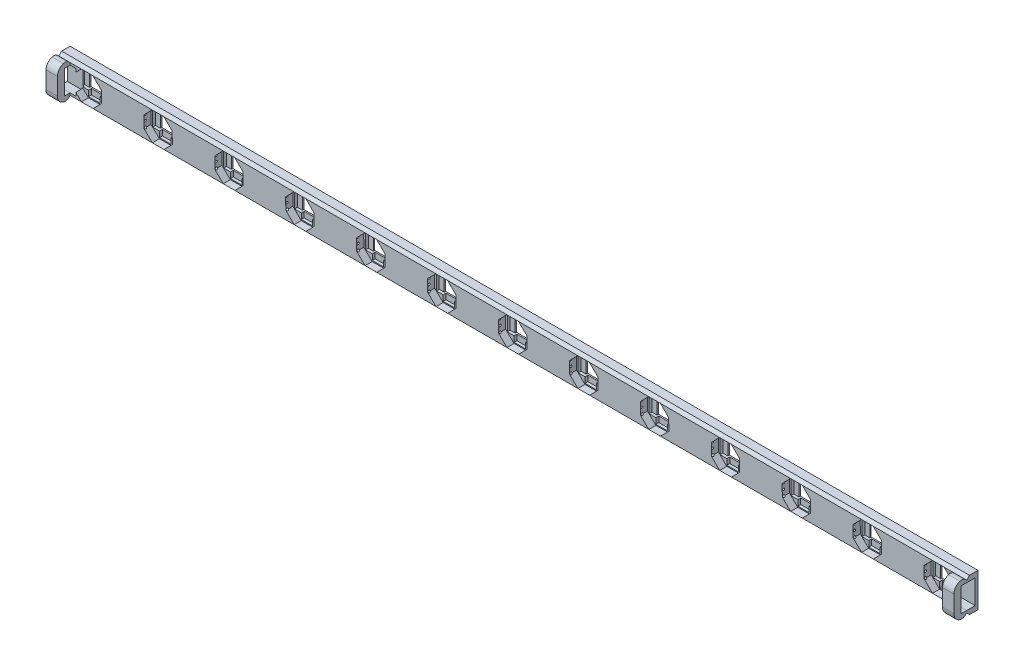
from build123d import *

# Parameters (mm, degrees)
SKETCH1_W                = 320
SKETCH1_H                = 12
BOSS_EXTRUDE1_DEPTH      = 4
CUT_EXTRUDE1_DEPTH       = 2.5
SKETCH4_W                = 5.3
SKETCH4_H                = 5.3
CUT_EXTRUDE2_DEPTH       = 330.788716717
SKETCH6_W                = 4
SKETCH6_H                = 2
CUT_EXTRUDE3_DEPTH       = 1
SKETCH7_W                = 4
SKETCH7_H                = 2
CUT_EXTRUDE4_DEPTH       = 1
SKETCH10_W               = 1.75
SKETCH10_H               = 5.333464967
SKETCH10_H_2             = 5.3
CUT_EXTRUDE7_DEPTH       = 1
CUT_EXTRUDE8_DEPTH       = 321.107409259
CUT_EXTRUDE8_DEPTH_BACK  = 321.107409259
SKETCH11_R               = 0.375
CUT_EXTRUDE9_DEPTH       = 321.107409259
CUT_EXTRUDE9_DEPTH_BACK  = 321.107409259
SKETCH12_R               = 0.375
CUT_EXTRUDE10_DEPTH      = 321.107409259
CUT_EXTRUDE10_DEPTH_BACK = 321.107409259
SKETCH13_R               = 0.375
CUT_EXTRUDE11_DEPTH      = 330.803498577
CUT_EXTRUDE11_DEPTH_BACK = 3
SKETCH14_W               = 6
SKETCH14_H               = 8.5
SKETCH15_W               = 4
SKETCH15_H               = 12
BOSS_EXTRUDE2_DEPTH      = 4.5
SKETCH16_W               = 2
SKETCH16_H               = 8.500297862
CUT_EXTRUDE12_DEPTH      = 4.5
FILLET1_R                = 3
FILLET2_R                = 3
SKETCH17_W               = 6
SKETCH17_H               = 8.5
CUT_EXTRUDE13_DEPTH      = 3
SKETCH18_W               = 4
SKETCH18_H               = 12
BOSS_EXTRUDE3_DEPTH      = 4.5
SKETCH19_W               = 2
SKETCH19_H               = 8.49933276
CUT_EXTRUDE14_DEPTH      = 4.5
FILLET3_R                = 3
FILLET4_R                = 3
CHAMFER1_SIZE            = 1
CHAMFER2_SIZE            = 1
CUT_EXTRUDE15_DEPTH      = 317.197728427
CUT_EXTRUDE15_DEPTH_BACK = 317.197728427
CUT_EXTRUDE16_DEPTH      = 317.197728427
CUT_EXTRUDE16_DEPTH_BACK = 317.197728427
CHAMFER3_SIZE            = 1
CHAMFER4_SIZE            = 1
CHAMFER5_SIZE            = 1
CHAMFER6_SIZE            = 1
FILLET5_R                = 2
FILLET6_R                = 2
FILLET7_R                = 2
FILLET8_R                = 2
LPATTERN1_COUNT          = 13
LPATTERN1_PITCH          = 25


# Some blends are built 0.0001 mm under size
with BuildPart() as part:
    # Sketch1 → Boss-Extrude1 (new body)
    with BuildSketch(Plane.XY):
        with Locations((-169.69924812, 1.263157895)):
            Rectangle(SKETCH1_W, SKETCH1_H)
    extrude(amount=BOSS_EXTRUDE1_DEPTH)

    # Sketch3 → Cut-Extrude1 (cut)
    with BuildSketch(Plane.XY.offset(4)):
        Polygon((-17.589220634, -3.720526073), (-14.683236648, -0.76882409), (-14.715564153, 3.373185381), (-17.667266136, 6.279169368), (-21.809275607, 6.246841862), (-24.715259593, 3.295139879), (-24.682932088, -0.846869592), (-21.731230105, -3.752853578), align=None)
    cut_extrude1 = extrude(amount=-CUT_EXTRUDE1_DEPTH, mode=Mode.SUBTRACT)

    # Sketch4 → Cut-Extrude2 (cut, through all)
    with BuildSketch(Plane.XY.offset(1.5)):
        with Locations((-19.69924812, 1.263157895)):
            Rectangle(SKETCH4_W, SKETCH4_H)
    cut_extrude2 = extrude(amount=-CUT_EXTRUDE2_DEPTH, mode=Mode.SUBTRACT)

    # Sketch6 → Cut-Extrude3 (cut)
    with BuildSketch(Plane.XY.offset(1.5)):
        with Locations((-19.69924812, -2.386842105)):
            Rectangle(SKETCH6_W, SKETCH6_H)
    cut_extrude3 = extrude(amount=-CUT_EXTRUDE3_DEPTH, mode=Mode.SUBTRACT)

    # Sketch7 → Cut-Extrude4 (cut)
    with BuildSketch(Plane.XY.offset(1.5)):
        with Locations((-19.69924812, 4.913157895)):
            Rectangle(SKETCH7_W, SKETCH7_H)
    cut_extrude4 = extrude(amount=-CUT_EXTRUDE4_DEPTH, mode=Mode.SUBTRACT)

    # Sketch10 → Cut-Extrude7 (cut)
    with BuildSketch(Plane.XY.offset(1.5)):
        with Locations((-16.17424812, 1.246425412)):
            Rectangle(SKETCH10_W, SKETCH10_H)
        with Locations((-23.22424812, 1.263157895)):
            Rectangle(SKETCH10_W, SKETCH10_H_2)
    cut_extrude7 = extrude(amount=-CUT_EXTRUDE7_DEPTH, mode=Mode.SUBTRACT)

    # Sketch11 → Cut-Extrude8 (cut, two sides: drawn at the far end of the back side and taken through both)
    with BuildSketch(Plane(origin=(-9.69924812, 0, 0), x_dir=(0, 0, -1), z_dir=(1, 0, 0)).offset(-CUT_EXTRUDE8_DEPTH_BACK)):
        with Locations(Location((-3.5, 1.263157895, 0), (0, 0, 270))):
            Circle(SKETCH11_R)
    extrude(amount=CUT_EXTRUDE8_DEPTH + CUT_EXTRUDE8_DEPTH_BACK, mode=Mode.SUBTRACT)

    # Sketch12 → Cut-Extrude9 (cut, two sides: drawn at the far end of the back side and taken through both)
    with BuildSketch(Plane(origin=(-9.69924812, 0, 0), x_dir=(0, 0, -1), z_dir=(1, 0, 0)).offset(-CUT_EXTRUDE9_DEPTH_BACK)):
        with Locations(Location((-3.5, -0.736842105, 0), (0, 0, 355.107569496))):
            Circle(SKETCH12_R)
    extrude(amount=CUT_EXTRUDE9_DEPTH + CUT_EXTRUDE9_DEPTH_BACK, mode=Mode.SUBTRACT)

    # Sketch13 → Cut-Extrude10 (cut, two sides: drawn at the far end of the back side and taken through both)
    with BuildSketch(Plane(origin=(-9.69924812, 0, 0), x_dir=(0, 0, -1), z_dir=(1, 0, 0)).offset(-CUT_EXTRUDE10_DEPTH_BACK)):
        with Locations(Location((-3.5, 3.263157895, 0), (0, 0, 17.062016504))):
            Circle(SKETCH13_R)
    extrude(amount=CUT_EXTRUDE10_DEPTH + CUT_EXTRUDE10_DEPTH_BACK, mode=Mode.SUBTRACT)

    # Sketch14 → Cut-Extrude11 (cut, two sides: drawn at the far end of the back side and taken through both)
    with BuildSketch(Plane.XY.offset(4).offset(-CUT_EXTRUDE11_DEPTH_BACK)):
        with Locations((-12.69924812, 1.263157895)):
            Rectangle(SKETCH14_W, SKETCH14_H)
    extrude(amount=CUT_EXTRUDE11_DEPTH + CUT_EXTRUDE11_DEPTH_BACK, mode=Mode.SUBTRACT)

    # Sketch15 → Boss-Extrude2 (add)
    with BuildSketch(Plane.XY.offset(4)):
        with Locations((-11.69924812, 1.263157895)):
            Rectangle(SKETCH15_W, SKETCH15_H)
    extrude(amount=BOSS_EXTRUDE2_DEPTH)

    # Sketch16 → Cut-Extrude12 (cut)
    with BuildSketch(Plane(origin=(-9.69924812, 0, 0), x_dir=(0, 0, -1), z_dir=(1, 0, 0))):
        with Locations((-5, 1.263008964)):
            Rectangle(SKETCH16_W, SKETCH16_H)
    extrude(amount=-CUT_EXTRUDE12_DEPTH, mode=Mode.SUBTRACT)

    # Fillet1
    fillet1_edges = [part.edges().sort_by_distance(p)[0] for p in [
        (-11.69924812, 7.263157895, 8.5),
    ]]
    fillet(fillet1_edges, radius=FILLET1_R)

    # Fillet2
    fillet2_edges = [part.edges().sort_by_distance(p)[0] for p in [
        (-11.69924812, -4.736842105, 8.5),
    ]]
    fillet(fillet2_edges, radius=FILLET2_R)

    # Sketch17 → Cut-Extrude13 (cut)
    with BuildSketch(Plane.XY.offset(4)):
        with Locations((-326.69924812, 1.263157895)):
            Rectangle(SKETCH17_W, SKETCH17_H)
    extrude(amount=-CUT_EXTRUDE13_DEPTH, mode=Mode.SUBTRACT)

    # Sketch18 → Boss-Extrude3 (add)
    with BuildSketch(Plane.XY.offset(4)):
        with Locations((-327.69924812, 1.263157895)):
            Rectangle(SKETCH18_W, SKETCH18_H)
    extrude(amount=BOSS_EXTRUDE3_DEPTH)

    # Sketch19 → Cut-Extrude14 (cut)
    with BuildSketch(Plane.ZY.offset(329.69924812)):
        with Locations((5, 1.263491515)):
            Rectangle(SKETCH19_W, SKETCH19_H)
    extrude(amount=-CUT_EXTRUDE14_DEPTH, mode=Mode.SUBTRACT)

    # Fillet3
    fillet3_edges = [part.edges().sort_by_distance(p)[0] for p in [
        (-327.69924812, 7.263157895, 8.5),
    ]]
    fillet(fillet3_edges, radius=FILLET3_R)

    # Fillet4
    fillet4_edges = [part.edges().sort_by_distance(p)[0] for p in [
        (-327.69924812, -4.736842105, 8.5),
    ]]
    fillet(fillet4_edges, radius=FILLET4_R)

    # Chamfer1
    # the kernel refuses this chamfer: 1 mm, written as the material it takes off along each edge
    with BuildSketch(Plane(origin=(-325.69924812, 7.263157895, 4), x_dir=(0, 0.027495876610586487, -0.9996219169112968), z_dir=(1, 0, 0))) as chamfer1_piece_1:
        Polygon((CHAMFER1_SIZE * 0.999621916911, -CHAMFER1_SIZE * 0.0274958766106), (-CHAMFER1_SIZE * 0.0274958766106, -CHAMFER1_SIZE * 0.999621916911), (0, 0), align=None)
    extrude(amount=312, mode=Mode.SUBTRACT)

    # Chamfer2
    # the kernel refuses this chamfer: 1 mm, written as the material it takes off along each edge
    with BuildSketch(Plane(origin=(-13.69924812, -4.736842105, 4), x_dir=(0, 0.9996219169112968, 0.027495876610586487), z_dir=(-1, 0, 0))) as chamfer2_piece_1:
        Polygon((CHAMFER2_SIZE * 0.999621916911, CHAMFER2_SIZE * 0.0274958766106), (-CHAMFER2_SIZE * 0.0274958766106, CHAMFER2_SIZE * 0.999621916911), (0, 0), align=None)
    extrude(amount=312, mode=Mode.SUBTRACT)

    # Sketch30 → Cut-Extrude15 (cut, two sides: drawn at the far end of the back side and taken through both)
    with BuildSketch(Plane(origin=(-325.69924812, 0, 0), x_dir=(0, 0, -1), z_dir=(1, 0, 0)).offset(-CUT_EXTRUDE15_DEPTH_BACK)):
        Polygon((-3, -4.736842105), (-4, -3.736842105), (-4, -4.736842105), align=None)
    extrude(amount=CUT_EXTRUDE15_DEPTH + CUT_EXTRUDE15_DEPTH_BACK, mode=Mode.SUBTRACT)

    # Sketch31 → Cut-Extrude16 (cut, two sides: drawn at the far end of the back side and taken through both)
    with BuildSketch(Plane(origin=(-325.69924812, 0, 0), x_dir=(0, 0, -1), z_dir=(1, 0, 0)).offset(-CUT_EXTRUDE16_DEPTH_BACK)):
        Polygon((-4, 6.263157895), (-3, 7.263157895), (-4, 7.263157895), align=None)
    extrude(amount=CUT_EXTRUDE16_DEPTH + CUT_EXTRUDE16_DEPTH_BACK, mode=Mode.SUBTRACT)

    # Chamfer3
    chamfer3_edges = [part.edges().sort_by_distance(p)[0] for p in [
        (-327.69924812, 7.263157895, 4),
    ]]
    chamfer(chamfer3_edges, length=CHAMFER3_SIZE - 0.0001)  # a hair under: the kernel refuses the full size

    # Chamfer4
    chamfer4_edges = [part.edges().sort_by_distance(p)[0] for p in [
        (-11.69924812, 7.263157895, 4),
    ]]
    chamfer(chamfer4_edges, length=CHAMFER4_SIZE - 0.0001)  # a hair under: the kernel refuses the full size

    # Chamfer5
    chamfer5_edges = [part.edges().sort_by_distance(p)[0] for p in [
        (-11.69924812, -4.736842105, 4),
    ]]
    chamfer(chamfer5_edges, length=CHAMFER5_SIZE - 0.0001)  # a hair under: the kernel refuses the full size

    # Chamfer6
    chamfer6_edges = [part.edges().sort_by_distance(p)[0] for p in [
        (-327.69924812, -4.736842105, 4),
    ]]
    chamfer(chamfer6_edges, length=CHAMFER6_SIZE - 0.0001)  # a hair under: the kernel refuses the full size

    # Fillet5
    fillet5_edges = [part.edges().sort_by_distance(p)[0] for p in [
        (-11.69924812, 7.263157895, 4.9999),
    ]]
    fillet(fillet5_edges, radius=FILLET5_R)

    # Fillet6
    fillet6_edges = [part.edges().sort_by_distance(p)[0] for p in [
        (-11.69924812, -4.736842105, 4.9999),
    ]]
    fillet(fillet6_edges, radius=FILLET6_R)

    # Fillet7
    fillet7_edges = [part.edges().sort_by_distance(p)[0] for p in [
        (-327.69924812, -4.736842105, 4.9999),
    ]]
    fillet(fillet7_edges, radius=FILLET7_R)

    # Fillet8
    fillet8_edges = [part.edges().sort_by_distance(p)[0] for p in [
        (-327.69924812, 7.263157895, 4.9999),
    ]]
    fillet(fillet8_edges, radius=FILLET8_R)

    # LPattern1: Cut-Extrude1, Cut-Extrude2, Cut-Extrude3, Cut-Extrude4, Cut-Extrude7 ×13
    with Locations(*[(-i * LPATTERN1_PITCH, 0, 0) for i in range(1, LPATTERN1_COUNT)]):
        add(cut_extrude1, mode=Mode.SUBTRACT)
        add(cut_extrude2, mode=Mode.SUBTRACT)
        add(cut_extrude3, mode=Mode.SUBTRACT)
        add(cut_extrude4, mode=Mode.SUBTRACT)
        add(cut_extrude7, mode=Mode.SUBTRACT)


solid = part.part
